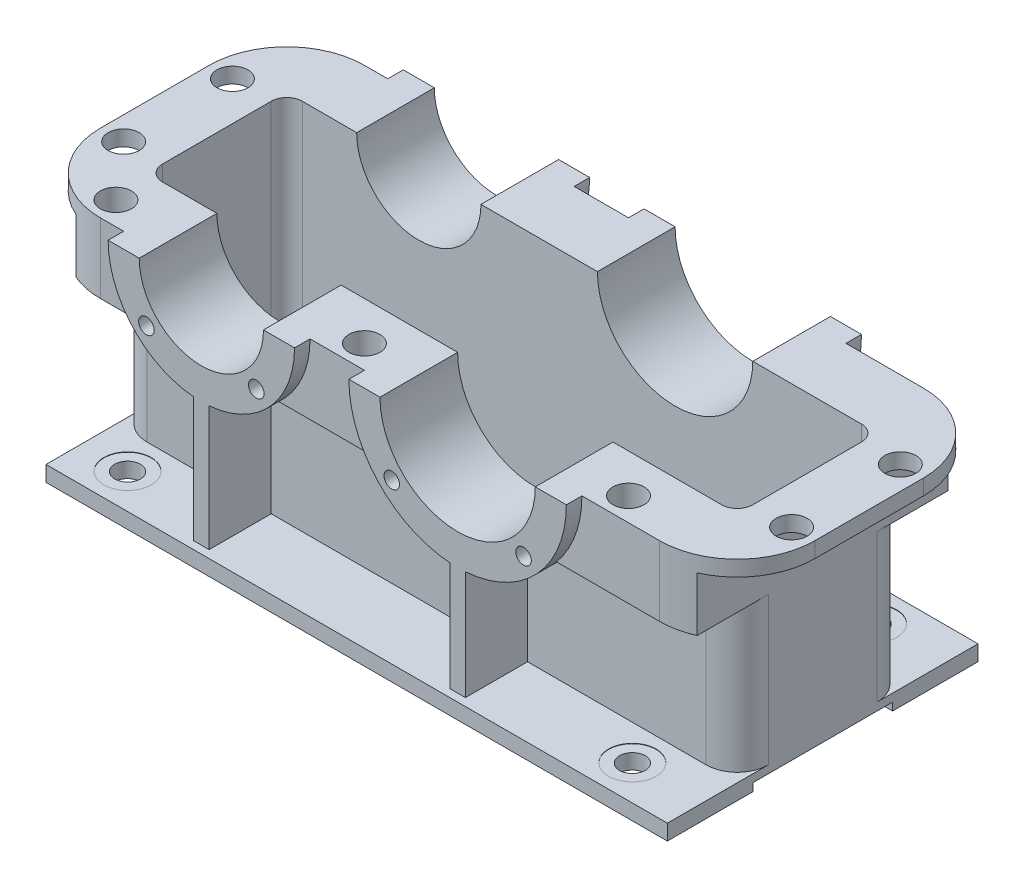
from build123d import *

# Parameters (mm, degrees)
SKETCH_2_W             = 800
SKETCH_2_H             = 220
EXTRUDE_1_DEPTH        = 300
FILLET_1_R             = 40
SHELL_1_T              = -20
EXTRUDE_2_DEPTH        = 20
SKETCH_5_W             = 800
SKETCH_5_H             = 400
EXTRUDE_3_DEPTH        = 20
EXTRUDE_4_DEPTH        = 90
EXTRUDE_5_DEPTH        = 100
RIB_8_REACH            = 684.935
SKETCH_10_WALL_W       = 1507.869686318
SKETCH_10_WALL_H       = 20
RIB_9_REACH            = 762.855
SKETCH_12_WALL_W       = 1683.70956493
SKETCH_12_WALL_H       = 20
SKETCH_13_R            = 100
SKETCH_13_R_2          = 80
CUT_EXTRUDE_1_DEPTH    = 100
SKETCH_14_R            = 10
CUT_EXTRUDE_2_DEPTH    = 20
CUT_EXTRUDE_3_REACH    = 684.935
SKETCH_15_R            = 20
M30_C_1_D              = 33
M30_C_1_DEPTH          = 20
M30_C_1_CBORE_D        = 61
M30_C_1_CBORE_DEPTH    = 0.5
PATTERN_LINEAR_1_COUNT = 2
PATTERN_LINEAR_1_PITCH = 650
MIRROR_START           = 90
MIRROR_1_DEPTH         = 80
MIRROR_START_2         = -161.096
MIRROR_1_2_DEPTH       = 51.096
MIRROR_START_3         = 110
MIRROR_1_3_OUTLINE_R   = 10
MIRROR_1_3_DEPTH       = 80
MIRROR_START_4         = -110
MIRROR_1_4_DEPTH       = 20
MIRROR_START_5         = -170
MIRROR_1_5_DEPTH       = 9.9999999
MIRROR_1_6_DEPTH       = 60
MIRROR_START_6         = 210
MIRROR_1_7_OUTLINE_R   = 20
MIRROR_1_7_DEPTH       = 90
MIRROR_1_8_OUTLINE_R   = 16.5
MIRROR_1_8_DEPTH       = 20
MIRROR_START_7         = 19.5
MIRROR_1_9_OUTLINE_R   = 30.5
MIRROR_1_9_OUTLINE_R_2 = 16.5
MIRROR_1_9_DEPTH       = 0.5
MIRROR_1_10_OUTLINE_R  = 20
MIRROR_1_10_DEPTH      = 90
CUT_EXTRUDE_4_REACH    = 752.533
SKETCH_19_W            = 180
SKETCH_19_H            = 10
CUT_EXTRUDE_5_DEPTH    = 933.52345815
SKETCH_20_R            = 40
EXTRUDE_6_DEPTH        = 10
EXTRUDE_6_TAPER        = 18
CUT_EXTRUDE_6_REACH    = 943.754
SKETCH_21_R            = 15


with BuildPart() as part:
    # 草图2 → 凸台-拉伸1 (new body)
    with BuildSketch(Plane(origin=(0, 0, 0), x_dir=(1, 0, 0), z_dir=(0, 1, 0))):
        with Locations((-120, 0)):
            Rectangle(SKETCH_2_W, SKETCH_2_H)
    extrude(amount=EXTRUDE_1_DEPTH)

    # 圆角1
    fillet_1_edges = [part.edges().sort_by_distance(p)[0] for p in [
        (280, 150, 110),
        (-520, 150, 110),
        (-520, 150, -110),
        (280, 150, -110),
    ]]
    fillet(fillet_1_edges, radius=FILLET_1_R)

    # 抽壳1
    shell_1_openings = [part.faces().sort_by_distance(p)[0] for p in [
        (-120, 300, 0),
    ]]
    offset(amount=SHELL_1_T, openings=shell_1_openings, kind=Kind.INTERSECTION)

    # 草图3 → 凸台-拉伸2 (add)
    with BuildSketch(Plane(origin=(0, 300, 0), x_dir=(1, 0, 0), z_dir=(0, 1, 0))):
        with BuildLine():
            Line((240, 170), (-480, 170))
            ThreePointArc((-480, 170), (-550.710678119, 140.710678119), (-580, 70))
            Line((-580, 70), (-580, -70))
            ThreePointArc((-580, -70), (-550.710678119, -140.710678119), (-480, -170))
            Line((-480, -170), (240, -170))
            ThreePointArc((240, -170), (310.710678119, -140.710678119), (340, -70))
            Line((340, -70), (340, 70))
            ThreePointArc((340, 70), (310.710678119, 140.710678119), (240, 170))
        make_face()
        with BuildLine():
            Line((280, -70), (280, 70))
            ThreePointArc((280, 70), (268.284271247, 98.284271247), (240, 110))
            Line((240, 110), (-480, 110))
            ThreePointArc((-480, 110), (-508.284271247, 98.284271247), (-520, 70))
            Line((-520, 70), (-520, -70))
            ThreePointArc((-520, -70), (-508.284271247, -98.284271247), (-480, -110))
            Line((-480, -110), (240, -110))
            ThreePointArc((240, -110), (268.284271247, -98.284271247), (280, -70))
        make_face(mode=Mode.SUBTRACT)
    extrude(amount=-EXTRUDE_2_DEPTH)

    # 草图5 → 凸台-拉伸3 (add)
    with BuildSketch(Plane.XZ):
        with Locations((-120, 0)):
            Rectangle(SKETCH_5_W, SKETCH_5_H)
    extrude(amount=-EXTRUDE_3_DEPTH)

    # 草图6 → 凸台-拉伸4 (add)
    with BuildSketch(Plane(origin=(0, 300, 0), x_dir=(1, 0, 0), z_dir=(0, 1, 0))):
        with BuildLine():
            Line((240, -110), (-480, -110))
            ThreePointArc((-480, -110), (-508.284271247, -98.284271247), (-520, -70))
            Line((-520, -70), (-520, -161.651513899))
            ThreePointArc((-520, -161.651513899), (-500.430964369, -167.890631293), (-480, -170))
            Line((-480, -170), (240, -170))
            ThreePointArc((240, -170), (260.430964369, -167.890631293), (280, -161.651513899))
            Line((280, -161.651513899), (280, -70))
            ThreePointArc((280, -70), (268.284271247, -98.284271247), (240, -110))
        make_face()
    extrude(amount=-EXTRUDE_4_DEPTH)

    # 草图9 → 凸台-拉伸5 (add)
    with BuildSketch(Plane.XY.offset(-90)):
        with BuildLine():
            Line((-450, 300), (-210, 300))
            ThreePointArc((-210, 300), (-330, 180), (-450, 300))
        make_face()
        with BuildLine():
            Line((-140, 300), (140, 300))
            ThreePointArc((140, 300), (0, 160), (-140, 300))
        make_face()
    extrude(amount=-EXTRUDE_5_DEPTH)

    # 草图10 wall → 筋8 (add, up to next)
    with BuildSketch(Plane(origin=(0, 90, -190), x_dir=(0, -1, 0), z_dir=(0, 0, -1)), mode=Mode.PRIVATE) as rib_8_sk1:
        Rectangle(SKETCH_10_WALL_W, SKETCH_10_WALL_H)
    rib_8_tool1 = extrude(rib_8_sk1.sketch, amount=-RIB_8_REACH, mode=Mode.PRIVATE) - part.part
    add(rib_8_tool1.solids().sort_by_distance((0, 90, -190))[0])

    # 草图12 wall → 筋9 (add, up to next)
    with BuildSketch(Plane(origin=(-330, 100, -190), x_dir=(0, -1, 0), z_dir=(0, 0, -1)), mode=Mode.PRIVATE) as rib_9_sk1:
        Rectangle(SKETCH_12_WALL_W, SKETCH_12_WALL_H)
    rib_9_tool1 = extrude(rib_9_sk1.sketch, amount=-RIB_9_REACH, mode=Mode.PRIVATE) - part.part
    add(rib_9_tool1.solids().sort_by_distance((-330, 100, -190))[0])

    # 草图13 → 切除-拉伸1 (cut)
    with BuildSketch(Plane(origin=(0, 0, -190), x_dir=(-1, 0, 0), z_dir=(0, 0, -1))):
        with Locations((0, 300)):
            Circle(SKETCH_13_R)
        with Locations((330, 300)):
            Circle(SKETCH_13_R_2)
    extrude(amount=-CUT_EXTRUDE_1_DEPTH, mode=Mode.SUBTRACT)

    # 草图14 → 切除-拉伸2 (cut)
    with BuildSketch(Plane(origin=(0, 0, -190), x_dir=(-1, 0, 0), z_dir=(0, 0, -1))):
        with Locations((84.852813742, 215.147186258)):
            Circle(SKETCH_14_R)
        with Locations(Location((-84.852813742, 215.147186258, 0), (0, 0, 180))):
            Circle(SKETCH_14_R)
        with Locations((400.710678119, 229.289321881)):
            Circle(SKETCH_14_R)
        with Locations(Location((259.289321881, 229.289321881, 0), (0, 0, 180))):
            Circle(SKETCH_14_R)
    extrude(amount=-CUT_EXTRUDE_2_DEPTH, mode=Mode.SUBTRACT)

    # 草图15 → 切除-拉伸3 (cut, up to next)
    with BuildSketch(Plane(origin=(0, 300, 0), x_dir=(1, 0, 0), z_dir=(0, 1, 0)), mode=Mode.PRIVATE) as cut_extrude_3_sk1:
        with Locations(Location((-490, 140, 0), (0, 0, 270))):
            Circle(SKETCH_15_R)
    cut_extrude_3_tool1 = extrude(cut_extrude_3_sk1.sketch, amount=-CUT_EXTRUDE_3_REACH, mode=Mode.PRIVATE) & part.part
    # 草图15 → 切除-拉伸3 (cut, up to next)
    with BuildSketch(Plane(origin=(0, 300, 0), x_dir=(1, 0, 0), z_dir=(0, 1, 0)), mode=Mode.PRIVATE) as cut_extrude_3_sk2:
        with Locations(Location((-550, 70, 0), (0, 0, 270))):
            Circle(SKETCH_15_R)
    cut_extrude_3_tool2 = extrude(cut_extrude_3_sk2.sketch, amount=-CUT_EXTRUDE_3_REACH, mode=Mode.PRIVATE) & part.part
    # 草图15 → 切除-拉伸3 (cut, up to next)
    with BuildSketch(Plane(origin=(0, 300, 0), x_dir=(1, 0, 0), z_dir=(0, 1, 0)), mode=Mode.PRIVATE) as cut_extrude_3_sk3:
        with Locations(Location((-170, 140, 0), (0, 0, 270))):
            Circle(SKETCH_15_R)
    cut_extrude_3_tool3 = extrude(cut_extrude_3_sk3.sketch, amount=-CUT_EXTRUDE_3_REACH, mode=Mode.PRIVATE) & part.part
    # 草图15 → 切除-拉伸3 (cut, up to next)
    with BuildSketch(Plane(origin=(0, 300, 0), x_dir=(1, 0, 0), z_dir=(0, 1, 0)), mode=Mode.PRIVATE) as cut_extrude_3_sk4:
        with Locations(Location((170, 140, 0), (0, 0, 270))):
            Circle(SKETCH_15_R)
    cut_extrude_3_tool4 = extrude(cut_extrude_3_sk4.sketch, amount=-CUT_EXTRUDE_3_REACH, mode=Mode.PRIVATE) & part.part
    # 草图15 → 切除-拉伸3 (cut, up to next)
    with BuildSketch(Plane(origin=(0, 300, 0), x_dir=(1, 0, 0), z_dir=(0, 1, 0)), mode=Mode.PRIVATE) as cut_extrude_3_sk5:
        with Locations(Location((310, 70, 0), (0, 0, 270))):
            Circle(SKETCH_15_R)
    cut_extrude_3_tool5 = extrude(cut_extrude_3_sk5.sketch, amount=-CUT_EXTRUDE_3_REACH, mode=Mode.PRIVATE) & part.part
    add(cut_extrude_3_tool1.solids().sort_by_distance((-490, 300, -140))[0], mode=Mode.SUBTRACT)
    add(cut_extrude_3_tool2.solids().sort_by_distance((-550, 300, -70))[0], mode=Mode.SUBTRACT)
    add(cut_extrude_3_tool3.solids().sort_by_distance((-170, 300, -140))[0], mode=Mode.SUBTRACT)
    add(cut_extrude_3_tool4.solids().sort_by_distance((170, 300, -140))[0], mode=Mode.SUBTRACT)
    add(cut_extrude_3_tool5.solids().sort_by_distance((310, 300, -70))[0], mode=Mode.SUBTRACT)

    # M30 六角头螺栓C级的柱形沉头孔1
    with Locations(Plane(origin=(-460, 20, -155), x_dir=(0, 0, 1), z_dir=(0, 1, 0))):
        with Locations((0, 0)):
            m30_c_1 = CounterBoreHole(M30_C_1_D / 2, M30_C_1_CBORE_D / 2, M30_C_1_CBORE_DEPTH, depth=M30_C_1_DEPTH)

    # 阵列(线性)1: M30 六角头螺栓C级的柱形沉头孔1 ×2
    with Locations(*[(i * PATTERN_LINEAR_1_PITCH, 0, 0) for i in range(1, PATTERN_LINEAR_1_COUNT)]):
        add(m30_c_1, mode=Mode.SUBTRACT)

    # 镜向1: read off the stored shape, not the designer's step
    # 镜向1 outline → 镜向1 (cut)
    with BuildSketch(Plane.XY.offset(MIRROR_START)):
        with BuildLine():
            Line((-250, 300), (-410, 300))
            ThreePointArc((-410, 300), (-330, 220), (-250, 300))
        make_face()
        with BuildLine():
            Line((100, 300), (-100, 300))
            ThreePointArc((-100, 300), (0, 200), (100, 300))
        make_face()
    extrude(amount=MIRROR_1_DEPTH, mode=Mode.SUBTRACT)

    # Mirror 1 2 outline → Mirror 1 2 (add)
    with BuildSketch(Plane.XY.offset(MIRROR_START_2)):
        with BuildLine():
            Line((-250, 300), (-410, 300))
            ThreePointArc((-410, 300), (-330, 220), (-250, 300))
        make_face()
        with BuildLine():
            ThreePointArc((-409.372539332, 210), (-434.860587223, 241.653986878), (-448.321595662, 280))
            Line((-448.321595662, 280), (-520, 280))
            Line((-520, 280), (-520, 210))
            Line((-520, 210), (-409.372539332, 210))
        make_face()
        with BuildLine():
            Line((-140, 300), (-210, 300))
            ThreePointArc((-210, 300), (-220.627460668, 250.627460668), (-250.627460668, 210))
            Line((-250.627460668, 210), (-107.238052948, 210))
            ThreePointArc((-107.238052948, 210), (-131.554793552, 252.111209102), (-140, 300))
        make_face()
        with BuildLine():
            Line((100, 300), (-100, 300))
            ThreePointArc((-100, 300), (-84.731632061, 246.89114454), (-43.588989435, 210))
            Line((-43.588989435, 210), (43.588989435, 210))
            ThreePointArc((43.588989435, 210), (84.731632061, 246.89114454), (100, 300))
        make_face()
        with BuildLine():
            Line((280, 280), (138.564064606, 280))
            ThreePointArc((138.564064606, 280), (127.78759818, 242.813202996), (107.238052948, 210))
            Line((107.238052948, 210), (280, 210))
            Line((280, 210), (280, 280))
        make_face()
    extrude(amount=MIRROR_1_2_DEPTH)

    # Mirror 1 3 outline → Mirror 1 3 (add)
    # profile 1 of 2: a face of its own
    with BuildSketch(Plane.XY.offset(MIRROR_START_3)):
        with BuildLine():
            Line((-410, 300), (-450, 300))
            ThreePointArc((-450, 300), (-418.317608663, 218.759615954), (-340, 180.417392569))
            Line((-340, 180.417392569), (-340, 20))
            Line((-340, 20), (-320, 20))
            Line((-320, 20), (-320, 180.417392569))
            ThreePointArc((-320, 180.417392569), (-241.682391337, 218.759615954), (-210, 300))
            Line((-210, 300), (-250, 300))
            ThreePointArc((-250, 300), (-330, 220), (-410, 300))
        make_face()
        with Locations((-400.710678119, 229.289321881)):
            Circle(MIRROR_1_3_OUTLINE_R, mode=Mode.SUBTRACT)
        with Locations((-259.289321881, 229.289321881)):
            Circle(MIRROR_1_3_OUTLINE_R, mode=Mode.SUBTRACT)
    # profile 2 of 2: a face of its own
    with BuildSketch(Plane.XY.offset(MIRROR_START_3)):
        with BuildLine():
            Line((-100, 300), (-140, 300))
            ThreePointArc((-140, 300), (-102.46950766, 204.606079858), (-10, 160.357599562))
            Line((-10, 160.357599562), (-10, 20))
            Line((-10, 20), (10, 20))
            Line((10, 20), (10, 160.357599562))
            ThreePointArc((10, 160.357599562), (102.46950766, 204.606079858), (140, 300))
            Line((140, 300), (100, 300))
            ThreePointArc((100, 300), (0, 200), (-100, 300))
        make_face()
        with Locations((-84.852813742, 215.147186258)):
            Circle(MIRROR_1_3_OUTLINE_R, mode=Mode.SUBTRACT)
        with Locations((84.852813742, 215.147186258)):
            Circle(MIRROR_1_3_OUTLINE_R, mode=Mode.SUBTRACT)
    extrude(amount=MIRROR_1_3_DEPTH)

    # Mirror 1 4 outline → Mirror 1 4 (add)
    with BuildSketch(Plane.XY.offset(MIRROR_START_4)):
        with BuildLine():
            ThreePointArc((-409.372539332, 210), (-434.860587223, 241.653986878), (-448.321595662, 280))
            Line((-448.321595662, 280), (-520, 280))
            Line((-520, 280), (-520, 210))
            Line((-520, 210), (-409.372539332, 210))
        make_face()
        with BuildLine():
            Line((280, 280), (138.564064606, 280))
            ThreePointArc((138.564064606, 280), (127.78759818, 242.813202996), (107.238052948, 210))
            Line((107.238052948, 210), (280, 210))
            Line((280, 210), (280, 280))
        make_face()
    extrude(amount=MIRROR_1_4_DEPTH)

    # Mirror 1 5 outline → Mirror 1 5 (add)
    with BuildSketch(Plane.XY.offset(MIRROR_START_5)):
        with BuildLine():
            Line((-250, 300), (-410, 300))
            ThreePointArc((-410, 300), (-330, 220), (-250, 300))
        make_face()
        with BuildLine():
            ThreePointArc((-211.678404338, 280), (-225.139412777, 241.653986878), (-250.627460668, 210))
            Line((-250.627460668, 210), (-107.238052948, 210))
            ThreePointArc((-107.238052948, 210), (-127.78759818, 242.813202996), (-138.564064606, 280))
            Line((-138.564064606, 280), (-211.678404338, 280))
        make_face()
        with BuildLine():
            Line((100, 300), (-100, 300))
            ThreePointArc((-100, 300), (-84.731632061, 246.89114454), (-43.588989435, 210))
            Line((-43.588989435, 210), (43.588989435, 210))
            ThreePointArc((43.588989435, 210), (84.731632061, 246.89114454), (100, 300))
        make_face()
    extrude(amount=MIRROR_1_5_DEPTH)

    # Mirror 1 6 outline → Mirror 1 6 (add)
    with BuildSketch(Plane.XY.offset(MIRROR_START_3)):
        with BuildLine():
            Line((-76.279222101, 210), (-93.426405383, 210))
            ThreePointArc((-93.426405383, 210), (-84.852813742, 205.147186258), (-76.279222101, 210))
        make_face()
        with BuildLine():
            Line((93.426405383, 210), (76.279222101, 210))
            ThreePointArc((76.279222101, 210), (84.852813742, 205.147186258), (93.426405383, 210))
        make_face()
    extrude(amount=MIRROR_1_6_DEPTH)

    # Mirror 1 7 outline → Mirror 1 7 (cut)
    with BuildSketch(Plane(origin=(0, 0, 0), x_dir=(1, 0, 0), z_dir=(0, 1, 0)).offset(MIRROR_START_6)):
        with Locations((310, -70)):
            Circle(MIRROR_1_7_OUTLINE_R)
        with Locations((-550, -70)):
            Circle(MIRROR_1_7_OUTLINE_R)
        with Locations((170, -140)):
            Circle(MIRROR_1_7_OUTLINE_R)
        with Locations((-490, -140)):
            Circle(MIRROR_1_7_OUTLINE_R)
        with Locations((-170, -140)):
            Circle(MIRROR_1_7_OUTLINE_R)
    extrude(amount=MIRROR_1_7_DEPTH, mode=Mode.SUBTRACT)

    # Mirror 1 8 outline → Mirror 1 8 (cut)
    with BuildSketch(Plane(origin=(0, 0, 0), x_dir=(1, 0, 0), z_dir=(0, 1, 0))):
        with Locations((190, -155)):
            Circle(MIRROR_1_8_OUTLINE_R)
        with Locations((-460, -155)):
            Circle(MIRROR_1_8_OUTLINE_R)
    extrude(amount=MIRROR_1_8_DEPTH, mode=Mode.SUBTRACT)

    # Mirror 1 9 outline → Mirror 1 9 (cut)
    # profile 1 of 2: a face of its own
    with BuildSketch(Plane(origin=(0, 0, 0), x_dir=(1, 0, 0), z_dir=(0, 1, 0)).offset(MIRROR_START_7)):
        with Locations((190, -155)):
            Circle(MIRROR_1_9_OUTLINE_R)
        with Locations((190, -155)):
            Circle(MIRROR_1_9_OUTLINE_R_2, mode=Mode.SUBTRACT)
    # profile 2 of 2: a face of its own
    with BuildSketch(Plane(origin=(0, 0, 0), x_dir=(1, 0, 0), z_dir=(0, 1, 0)).offset(MIRROR_START_7)):
        with Locations((-460, -155)):
            Circle(MIRROR_1_9_OUTLINE_R)
        with Locations((-460, -155)):
            Circle(MIRROR_1_9_OUTLINE_R_2, mode=Mode.SUBTRACT)
    extrude(amount=MIRROR_1_9_DEPTH, mode=Mode.SUBTRACT)

    # Mirror 1 10 outline → Mirror 1 10 (add)
    with BuildSketch(Plane(origin=(0, 0, 0), x_dir=(1, 0, 0), z_dir=(0, 1, 0)).offset(MIRROR_START_6)):
        with BuildLine():
            ThreePointArc((280, 161.6515139), (260.430964369, 167.890631293), (240, 170))
            Line((240, 170), (-480, 170))
            ThreePointArc((-480, 170), (-500.430964369, 167.890631293), (-520, 161.6515139))
            Line((-520, 161.6515139), (-520, 161.096))
            Line((-520, 161.096), (280, 161.096))
            Line((280, 161.096), (280, 161.6515139))
        make_face()
        with BuildLine():
            Line((280, 70), (280, 90))
            Line((280, 90), (274.641016151, 90))
            ThreePointArc((274.641016151, 90), (278.637033051, 80.352761804), (280, 70))
        make_face()
        with BuildLine():
            ThreePointArc((-520, 70), (-518.637033051, 80.352761804), (-514.641016151, 90))
            Line((-514.641016151, 90), (-520, 90))
            Line((-520, 90), (-520, 70))
        make_face()
        with Locations((-490, 140)):
            Circle(MIRROR_1_10_OUTLINE_R)
        with Locations((170, 140)):
            Circle(MIRROR_1_10_OUTLINE_R)
    extrude(amount=MIRROR_1_10_DEPTH)

    # 草图18 → 切除-拉伸4 (cut, up to next)
    with BuildSketch(Plane(origin=(0, 0, -170), x_dir=(-1, 0, 0), z_dir=(0, 0, -1)), mode=Mode.PRIVATE) as cut_extrude_4_sk1:
        with BuildLine():
            Line((410, 300), (250, 300))
            ThreePointArc((250, 300), (330, 220), (410, 300))
        make_face()
    cut_extrude_4_tool1 = extrude(cut_extrude_4_sk1.sketch, amount=-CUT_EXTRUDE_4_REACH, mode=Mode.PRIVATE) & part.part
    # 草图18 → 切除-拉伸4 (cut, up to next)
    with BuildSketch(Plane(origin=(0, 0, -170), x_dir=(-1, 0, 0), z_dir=(0, 0, -1)), mode=Mode.PRIVATE) as cut_extrude_4_sk2:
        with BuildLine():
            Line((100, 300), (-100, 300))
            ThreePointArc((-100, 300), (0, 200), (100, 300))
        make_face()
    cut_extrude_4_tool2 = extrude(cut_extrude_4_sk2.sketch, amount=-CUT_EXTRUDE_4_REACH, mode=Mode.PRIVATE) & part.part
    add(cut_extrude_4_tool1.solids().sort_by_distance((-330, 266.046945, -170))[0], mode=Mode.SUBTRACT)
    add(cut_extrude_4_tool2.solids().sort_by_distance((0, 257.558682, -170))[0], mode=Mode.SUBTRACT)

    # 草图19 → 切除-拉伸5 (cut, through all)
    with BuildSketch(Plane(origin=(280, 0, 0), x_dir=(0, 0, -1), z_dir=(1, 0, 0))):
        with Locations((0, 5)):
            Rectangle(SKETCH_19_W, SKETCH_19_H)
    extrude(amount=-CUT_EXTRUDE_5_DEPTH, mode=Mode.SUBTRACT)

    # 草图20 → 凸台-拉伸6 (add)
    with BuildSketch(Plane.ZY.offset(520)):
        with Locations((0, 90)):
            Circle(SKETCH_20_R)
    extrude(amount=EXTRUDE_6_DEPTH, taper=EXTRUDE_6_TAPER)

    # 草图21 → 切除-拉伸6 (cut, up to next)
    with BuildSketch(Plane.ZY.offset(530), mode=Mode.PRIVATE) as cut_extrude_6_sk1:
        with Locations((0, 90)):
            Circle(SKETCH_21_R)
    cut_extrude_6_tool1 = extrude(cut_extrude_6_sk1.sketch, amount=-CUT_EXTRUDE_6_REACH, mode=Mode.PRIVATE) & part.part
    add(cut_extrude_6_tool1.solids().sort_by_distance((-530, 90, 0))[0], mode=Mode.SUBTRACT)


solid = part.part
